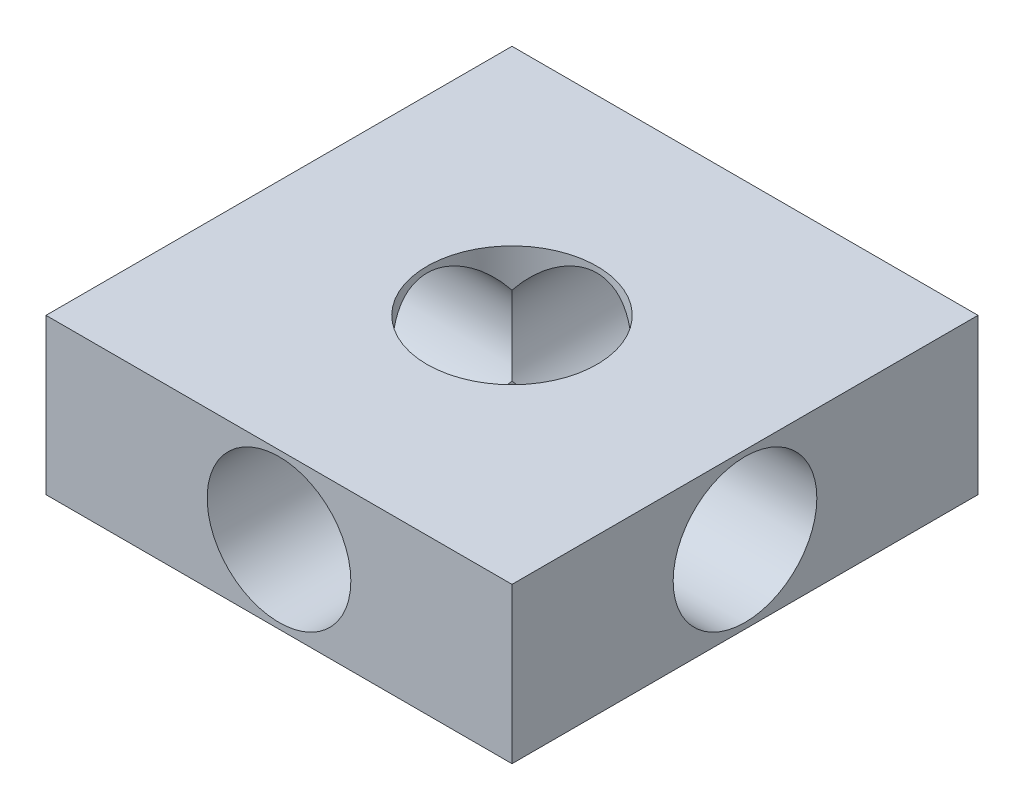
from build123d import *

# Parameters (mm, degrees)
SKETCH1_R           = 11
BOSS_EXTRUDE1_DEPTH = 10
SKETCH13_W          = 60
SKETCH13_H          = 60
BOSS_EXTRUDE5_DEPTH = 20
FACE_1_R            = 9.25
CUT_EXTRUDE1_DEPTH  = 20
FACE_3_R            = 9.25
CUT_EXTRUDE2_DEPTH  = 20
CUT_EXTRUDE3_START  = -20
FACE_2_R            = 9.25
CUT_EXTRUDE3_DEPTH  = 20
SKETCH14_R          = 1.42
CUT_EXTRUDE4_DEPTH  = 21
CUT_EXTRUDE5_START  = -22
SKETCH15_R          = 1.42
CUT_EXTRUDE5_DEPTH  = 22
SKETCH17_R          = 10.95
CUT_EXTRUDE10_DEPTH = 18
SKETCH18_R          = 9.25
CUT_EXTRUDE11_DEPTH = 56.5
SKETCH19_R          = 9.25
CUT_EXTRUDE12_DEPTH = 113


with BuildPart() as part:
    # Sketch1 → Boss-Extrude1 (new body)
    with BuildSketch(Plane(origin=(0, 0, 0), x_dir=(1, 0, 0), z_dir=(0, 1, 0))):
        Circle(SKETCH1_R)
    extrude(amount=BOSS_EXTRUDE1_DEPTH)

    # Sketch13 → Boss-Extrude5 (add)
    with BuildSketch(Plane(origin=(0, 10, 0), x_dir=(1, 0, 0), z_dir=(0, 1, 0))):
        Rectangle(SKETCH13_W, SKETCH13_H)
    extrude(amount=BOSS_EXTRUDE5_DEPTH)

    # Face 1 → Cut-Extrude1 (cut)
    with BuildSketch(Plane.XY.offset(30)):
        with Locations((0, 20)):
            Circle(FACE_1_R)
    extrude(amount=-CUT_EXTRUDE1_DEPTH, mode=Mode.SUBTRACT)

    # Face 3 → Cut-Extrude2 (cut)
    with BuildSketch(Plane.ZY.offset(30)):
        with Locations((0, 20)):
            Circle(FACE_3_R)
    extrude(amount=-CUT_EXTRUDE2_DEPTH, mode=Mode.SUBTRACT)

    # Face 2 → Cut-Extrude3 (cut)
    with BuildSketch(Plane(origin=(30, 0, 0), x_dir=(0, 0, -1), z_dir=(1, 0, 0)).offset(CUT_EXTRUDE3_START)):
        with Locations((0, 20)):
            Circle(FACE_2_R)
    extrude(amount=CUT_EXTRUDE3_DEPTH, mode=Mode.SUBTRACT)

    # Sketch14 → Cut-Extrude4 (cut)
    with BuildSketch(Plane.XZ):
        with Locations((-7.94, 0)):
            Circle(SKETCH14_R)
        with Locations((0, 7.94)):
            Circle(SKETCH14_R)
        with Locations((7.94, 0)):
            Circle(SKETCH14_R)
        with Locations((0, -7.94)):
            Circle(SKETCH14_R)
    extrude(amount=-CUT_EXTRUDE4_DEPTH, mode=Mode.SUBTRACT)

    # Sketch15 → Cut-Extrude5 (cut)
    with BuildSketch(Plane(origin=(0, 30, 0), x_dir=(1, 0, 0), z_dir=(0, 1, 0)).offset(CUT_EXTRUDE5_START)):
        with Locations((-7.94, 0)):
            Circle(SKETCH15_R)
        with Locations((0, 7.94)):
            Circle(SKETCH15_R)
        with Locations((7.94, 0)):
            Circle(SKETCH15_R)
        with Locations((0, -7.94)):
            Circle(SKETCH15_R)
    extrude(amount=CUT_EXTRUDE5_DEPTH, mode=Mode.SUBTRACT)

    # Sketch17 → Cut-Extrude10 (cut)
    with BuildSketch(Plane(origin=(0, 30, 0), x_dir=(1, 0, 0), z_dir=(0, 1, 0))):
        Circle(SKETCH17_R)
    extrude(amount=-CUT_EXTRUDE10_DEPTH, mode=Mode.SUBTRACT)

    # Sketch18 → Cut-Extrude11 (cut, symmetric)
    with BuildSketch(Plane(origin=(10, 0, 0), x_dir=(0, 0, -1), z_dir=(1, 0, 0))):
        with Locations((0, 20)):
            Circle(SKETCH18_R)
    extrude(amount=CUT_EXTRUDE11_DEPTH, both=True, mode=Mode.SUBTRACT)

    # Sketch19 → Cut-Extrude12 (cut)
    with BuildSketch(Plane.XY.offset(30)):
        with Locations((0, 20)):
            Circle(SKETCH19_R)
    extrude(amount=-CUT_EXTRUDE12_DEPTH, mode=Mode.SUBTRACT)


solid = part.part
